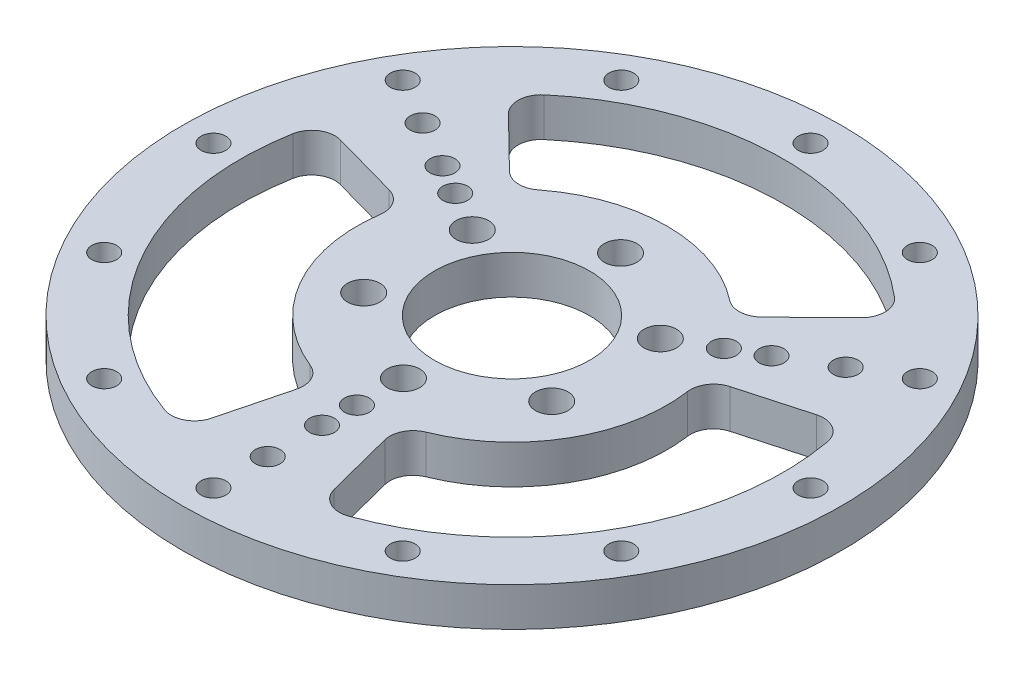
from build123d import *

# Parameters (mm, degrees)
SKETCH_1_R      = 42.5
SKETCH_1_R_2    = 10
SKETCH_1_R_3    = 2.1
SKETCH_1_R_4    = 1.6
EXTRUDE_1_DEPTH = 5
FILLET_1_R      = 3


with BuildPart() as part:
    # 草图1 → 凸台-拉伸1 (new body)
    with BuildSketch(Plane(origin=(0, 0, 0), x_dir=(1, 0, 0), z_dir=(0, 1, 0))):
        Circle(SKETCH_1_R)
        Circle(SKETCH_1_R_2, mode=Mode.SUBTRACT)
        with Locations((0, 14)):
            Circle(SKETCH_1_R_3, mode=Mode.SUBTRACT)
        with Locations((12.124355653, 7)):
            Circle(SKETCH_1_R_3, mode=Mode.SUBTRACT)
        with Locations((12.124355653, -7)):
            Circle(SKETCH_1_R_3, mode=Mode.SUBTRACT)
        with Locations((0, -14)):
            Circle(SKETCH_1_R_3, mode=Mode.SUBTRACT)
        with Locations((-12.124355653, -7)):
            Circle(SKETCH_1_R_3, mode=Mode.SUBTRACT)
        with Locations((-12.124355653, 7)):
            Circle(SKETCH_1_R_3, mode=Mode.SUBTRACT)
        with Locations((0, 38.5)):
            Circle(SKETCH_1_R_4, mode=Mode.SUBTRACT)
        with Locations((19.25, 33.341978046)):
            Circle(SKETCH_1_R_4, mode=Mode.SUBTRACT)
        with Locations((33.341978046, 19.25)):
            Circle(SKETCH_1_R_4, mode=Mode.SUBTRACT)
        with Locations((38.5, 0)):
            Circle(SKETCH_1_R_4, mode=Mode.SUBTRACT)
        with Locations((33.341978046, -19.25)):
            Circle(SKETCH_1_R_4, mode=Mode.SUBTRACT)
        with Locations((19.25, -33.341978046)):
            Circle(SKETCH_1_R_4, mode=Mode.SUBTRACT)
        with Locations((0, -38.5)):
            Circle(SKETCH_1_R_4, mode=Mode.SUBTRACT)
        with Locations((-19.25, -33.341978046)):
            Circle(SKETCH_1_R_4, mode=Mode.SUBTRACT)
        with Locations((-33.341978046, -19.25)):
            Circle(SKETCH_1_R_4, mode=Mode.SUBTRACT)
        with Locations((-38.5, 0)):
            Circle(SKETCH_1_R_4, mode=Mode.SUBTRACT)
        with Locations((-33.341978046, 19.25)):
            Circle(SKETCH_1_R_4, mode=Mode.SUBTRACT)
        with Locations((-19.25, 33.341978046)):
            Circle(SKETCH_1_R_4, mode=Mode.SUBTRACT)
        with Locations((-27.279800219, 15.75)):
            Circle(SKETCH_1_R_4, mode=Mode.SUBTRACT)
        with Locations((-21.217622393, 12.25)):
            Circle(SKETCH_1_R_4, mode=Mode.SUBTRACT)
        with Locations((-17.320508076, 10)):
            Circle(SKETCH_1_R_4, mode=Mode.SUBTRACT)
        with Locations((27.279800219, 15.75)):
            Circle(SKETCH_1_R_4, mode=Mode.SUBTRACT)
        with Locations((21.217622393, 12.25)):
            Circle(SKETCH_1_R_4, mode=Mode.SUBTRACT)
        with Locations((17.320508076, 10)):
            Circle(SKETCH_1_R_4, mode=Mode.SUBTRACT)
        with Locations((0, -31.5)):
            Circle(SKETCH_1_R_4, mode=Mode.SUBTRACT)
        with Locations((0, -24.5)):
            Circle(SKETCH_1_R_4, mode=Mode.SUBTRACT)
        with Locations((0, -20)):
            Circle(SKETCH_1_R_4, mode=Mode.SUBTRACT)
        with BuildLine():
            Line((-25, 24.494897428), (-14.285714286, 13.997084244))
            ThreePointArc((-14.285714286, 13.997084244), (0, 20), (14.285714286, 13.997084244))
            Line((14.285714286, 13.997084244), (25, 24.494897428))
            ThreePointArc((25, 24.494897428), (0, 35), (-25, 24.494897428))
        make_face(mode=Mode.SUBTRACT)
        with BuildLine():
            Line((8.713203436, -33.898083809), (4.978973392, -19.370333605))
            ThreePointArc((4.978973392, -19.370333605), (17.320508076, -10), (19.264687677, 5.37324936))
            Line((19.264687677, 5.37324936), (33.713203436, 9.403186381))
            ThreePointArc((33.713203436, 9.403186381), (30.310889132, -17.5), (8.713203436, -33.898083809))
        make_face(mode=Mode.SUBTRACT)
        with BuildLine():
            Line((-33.713203436, 9.403186381), (-19.264687677, 5.37324936))
            ThreePointArc((-19.264687677, 5.37324936), (-17.320508076, -10), (-4.978973392, -19.370333605))
            Line((-4.978973392, -19.370333605), (-8.713203436, -33.898083809))
            ThreePointArc((-8.713203436, -33.898083809), (-30.310889132, -17.5), (-33.713203436, 9.403186381))
        make_face(mode=Mode.SUBTRACT)
    extrude(amount=EXTRUDE_1_DEPTH)

    # 圆角1
    fillet_1_edges = [part.edges().sort_by_distance(p)[0] for p in [
        (25, 2.5, -24.494897428),
        (14.285714286, 2.5, -13.997084244),
        (-14.285714286, 2.5, -13.997084244),
        (-25, 2.5, -24.494897428),
        (19.264687677, 2.5, -5.37324936),
        (4.978973392, 2.5, 19.370333605),
        (33.713203436, 2.5, -9.403186381),
        (8.713203436, 2.5, 33.898083809),
        (-8.713203436, 2.5, 33.898083809),
        (-4.978973392, 2.5, 19.370333605),
        (-19.264687677, 2.5, -5.37324936),
        (-33.713203436, 2.5, -9.403186381),
    ]]
    fillet(fillet_1_edges, radius=FILLET_1_R)


solid = part.part
